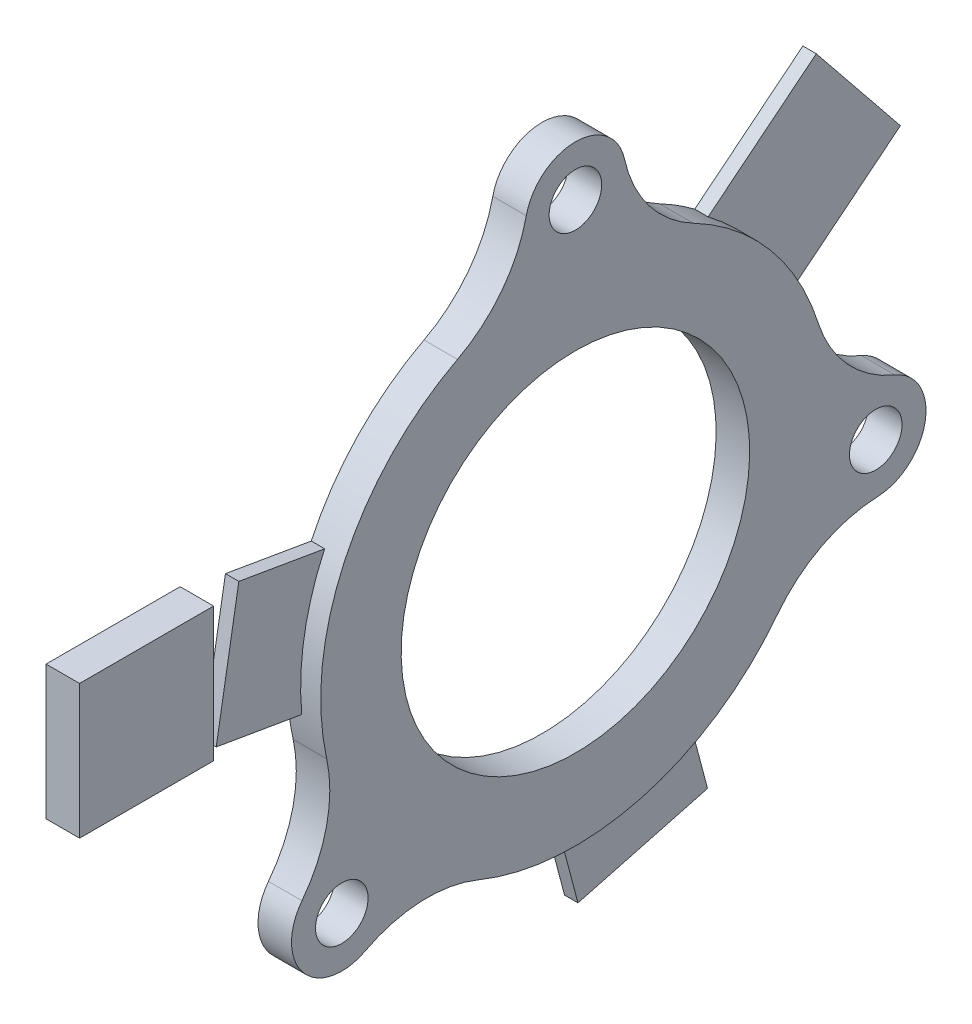
from build123d import *

# Parameters (mm, degrees)
SKETCH1_R           = 16.51
SKETCH1_R_2         = 2.4892
BOSS_EXTRUDE1_DEPTH = 3.175
CIRPATTERN1_COUNT   = 3
CIRPATTERN1_ANGLE   = 260
SKETCH2_W           = 12.7
SKETCH2_H           = 12.7
BOSS_EXTRUDE2_DEPTH = 3.175
BOSS_EXTRUDE3_DEPTH = 1.27


with BuildPart() as part:
    # Sketch1 → Boss-Extrude1 (new body)
    with BuildSketch(Plane(origin=(0, 0, 0), x_dir=(0, 0, -1), z_dir=(1, 0, 0))):
        with BuildLine():
            ThreePointArc((4.651349482, 29.915414585), (0, 33.655), (-4.651349482, 29.915414585))
            ThreePointArc((-4.651349482, 29.915414585), (-6.967053747, 24.927981855), (-11.173931514, 21.386915498))
            ThreePointArc((-11.173931514, 21.386915498), (0, -24.13), (11.173931514, 21.386915498))
            ThreePointArc((11.173931514, 21.386915498), (6.967053747, 24.927981855), (4.651349482, 29.915414585))
        make_face()
        Circle(SKETCH1_R, mode=Mode.SUBTRACT)
        with Locations((0, 28.8925)):
            Circle(SKETCH1_R_2, mode=Mode.SUBTRACT)
    extrude(amount=BOSS_EXTRUDE1_DEPTH)


with BuildPart() as cirpattern1_1:
    # CirPattern1: pattern copy
    add(part.part.rotate(Axis((0, 0, 0), (1, 0, 0)), 1 * CIRPATTERN1_ANGLE / (CIRPATTERN1_COUNT - 1)))


with BuildPart() as cirpattern1_2:
    # CirPattern1: pattern copy
    add(part.part.rotate(Axis((0, 0, 0), (1, 0, 0)), 2 * CIRPATTERN1_ANGLE / (CIRPATTERN1_COUNT - 1)))


with BuildPart() as part_1:
    add(part.part)

    # Combine1: read off the stored shape, not the designer's step
    # Combine1: union CirPattern1_2, CirPattern1_1
    add(cirpattern1_2.part)
    add(cirpattern1_1.part)

    # Sketch3 → Boss-Extrude3 (add)
    with BuildSketch(Plane.ZY):
        Polygon((-14.016942068, 18.930096526), (-21.987546991, 9.042758303), (-32.695735298, 17.675085478), (-24.725130374, 27.562423702), align=None)
        Polygon((20.292858755, 9.964170469), (22.435967923, -2.55370008), (32.12580998, -0.894760626), (29.982700812, 11.623109924), align=None)
        Polygon((-12.229834857, -19.295325852), (0.045762794, -22.551044254), (-2.148676213, -30.82511682), (-14.424273863, -27.569398418), align=None)
    extrude(amount=-BOSS_EXTRUDE3_DEPTH)


with BuildPart() as body_2:
    # Sketch2 → Boss-Extrude2 (new body)
    with BuildSketch(Plane.ZY):
        with Locations((40.626865076, 6.35)):
            Rectangle(SKETCH2_W, SKETCH2_H)
    extrude(amount=-BOSS_EXTRUDE2_DEPTH)


solid = Compound([part_1.part, body_2.part])
